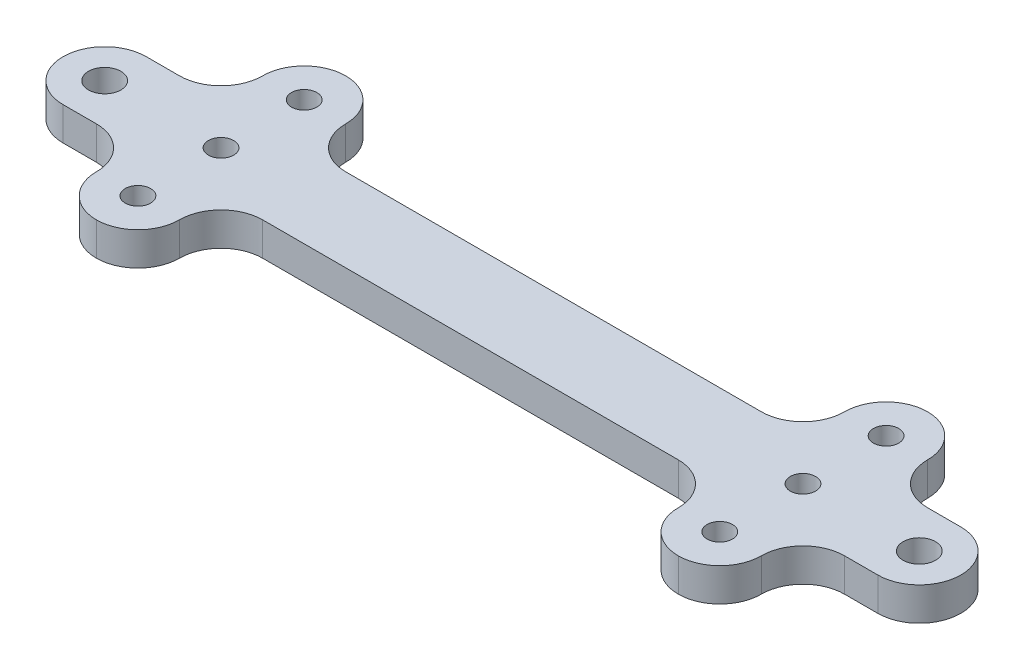
from build123d import *

# Parameters (mm, degrees)
BOSS_EXTRUDE1_START = -19.5
SKETCH1_R           = 1.95
BOSS_EXTRUDE1_DEPTH = 4
SKETCH2_W           = 10
SKETCH2_H           = 10
SKETCH2_R           = 1.525
BOSS_EXTRUDE2_DEPTH = 4
SKETCH2_3_R         = 1.525
CUT_EXTRUDE1_DEPTH  = 4
FILLET1_START       = -24
FILLET1_DEPTH       = 5
FILLET1_START_2     = -23.5
FILLET1_2_DEPTH     = 4


with BuildPart() as part:
    # Sketch1 → Boss-Extrude1 (new body)
    with BuildSketch(Plane(origin=(0, 0, 0), x_dir=(1, 0, 0), z_dir=(0, 1, 0)).offset(BOSS_EXTRUDE1_START)):
        with BuildLine():
            Line((43.9, 5), (-54.1, 5))
            ThreePointArc((-54.1, 5), (-59.1, 0), (-54.1, -5))
            Line((-54.1, -5), (43.9, -5))
            ThreePointArc((43.9, -5), (48.9, 0), (43.9, 5))
        make_face()
        with Locations(Location((43.9, 0, 0), (0, 0, 270))):
            Circle(SKETCH1_R, mode=Mode.SUBTRACT)
        with Locations(Location((-54.1, 0, 0), (0, 0, 270))):
            Circle(SKETCH1_R, mode=Mode.SUBTRACT)
    extrude(amount=-BOSS_EXTRUDE1_DEPTH)

    # Sketch2 → Boss-Extrude2 (add)
    # profile 1 of 4: a face of its own
    with BuildSketch(Plane(origin=(0, -19.5, 0), x_dir=(1, 0, 0), z_dir=(0, 1, 0))):
        with Locations((-40.1, -10)):
            Rectangle(SKETCH2_W, SKETCH2_H)
        with Locations(Location((-40.1, -10, 0), (0, 0, 270))):
            Circle(SKETCH2_R, mode=Mode.SUBTRACT)
    # profile 2 of 4: a face of its own
    with BuildSketch(Plane(origin=(0, -19.5, 0), x_dir=(1, 0, 0), z_dir=(0, 1, 0))):
        with Locations((-40.1, 10)):
            Rectangle(SKETCH2_W, SKETCH2_H)
        with Locations(Location((-40.1, 10, 0), (0, 0, 270))):
            Circle(SKETCH2_R, mode=Mode.SUBTRACT)
    # profile 3 of 4: a face of its own
    with BuildSketch(Plane(origin=(0, -19.5, 0), x_dir=(1, 0, 0), z_dir=(0, 1, 0))):
        with Locations((29.9, 10)):
            Rectangle(SKETCH2_W, SKETCH2_H)
        with Locations(Location((29.9, 10, 0), (0, 0, 270))):
            Circle(SKETCH2_R, mode=Mode.SUBTRACT)
    # profile 4 of 4: a face of its own
    with BuildSketch(Plane(origin=(0, -19.5, 0), x_dir=(1, 0, 0), z_dir=(0, 1, 0))):
        with Locations((29.9, -10)):
            Rectangle(SKETCH2_W, SKETCH2_H)
        with Locations(Location((29.9, -10, 0), (0, 0, 270))):
            Circle(SKETCH2_R, mode=Mode.SUBTRACT)
    extrude(amount=-BOSS_EXTRUDE2_DEPTH)

    # Sketch2<3> → Cut-Extrude1 (cut)
    with BuildSketch(Plane(origin=(0, -19.5, 0), x_dir=(1, 0, 0), z_dir=(0, 1, 0))):
        with Locations(Location((29.9, 0, 0), (0, 0, 270))):
            Circle(SKETCH2_3_R)
        with Locations(Location((-40.1, 0, 0), (0, 0, 270))):
            Circle(SKETCH2_3_R)
    extrude(amount=-CUT_EXTRUDE1_DEPTH, mode=Mode.SUBTRACT)

    # Fillet1: read off the stored shape, not the designer's step
    # Fillet1 outline → Fillet1 (cut)
    with BuildSketch(Plane(origin=(0, 0, 0), x_dir=(1, 0, 0), z_dir=(0, 1, 0)).offset(FILLET1_START)):
        with BuildLine():
            Line((34.9, -15), (34.9, -10))
            ThreePointArc((34.9, -10), (33.435533906, -13.535533906), (29.9, -15))
            Line((29.9, -15), (34.9, -15))
        make_face()
        with BuildLine():
            Line((-45.1, -15), (-40.1, -15))
            ThreePointArc((-40.1, -15), (-43.635533906, -13.535533906), (-45.1, -10))
            Line((-45.1, -10), (-45.1, -15))
        make_face()
        with BuildLine():
            Line((-35.1, -15), (-35.1, -10))
            ThreePointArc((-35.1, -10), (-36.564466094, -13.535533906), (-40.1, -15))
            Line((-40.1, -15), (-35.1, -15))
        make_face()
        with BuildLine():
            Line((24.9, -15), (29.9, -15))
            ThreePointArc((29.9, -15), (26.364466094, -13.535533906), (24.9, -10))
            Line((24.9, -10), (24.9, -15))
        make_face()
        with BuildLine():
            Line((34.9, 15), (29.9, 15))
            ThreePointArc((29.9, 15), (33.435533906, 13.535533906), (34.9, 10))
            Line((34.9, 10), (34.9, 15))
        make_face()
        with BuildLine():
            Line((24.9, 15), (24.9, 10))
            ThreePointArc((24.9, 10), (26.364466094, 13.535533906), (29.9, 15))
            Line((29.9, 15), (24.9, 15))
        make_face()
        with BuildLine():
            ThreePointArc((-45.1, 10), (-43.635533906, 13.535533906), (-40.1, 15))
            Line((-40.1, 15), (-45.1, 15))
            Line((-45.1, 15), (-45.1, 10))
        make_face()
        with BuildLine():
            ThreePointArc((-40.1, 15), (-36.564466094, 13.535533906), (-35.1, 10))
            Line((-35.1, 10), (-35.1, 15))
            Line((-35.1, 15), (-40.1, 15))
        make_face()
    extrude(amount=FILLET1_DEPTH, mode=Mode.SUBTRACT)

    # Fillet1 2 outline → Fillet1 2 (add)
    with BuildSketch(Plane(origin=(0, 0, 0), x_dir=(1, 0, 0), z_dir=(0, 1, 0)).offset(FILLET1_START_2)):
        with BuildLine():
            Line((34.9, -5), (34.9, -10))
            ThreePointArc((34.9, -10), (36.364466094, -6.464466094), (39.9, -5))
            Line((39.9, -5), (34.9, -5))
        make_face()
        with BuildLine():
            ThreePointArc((-50.1, -5), (-46.564466094, -6.464466094), (-45.1, -10))
            Line((-45.1, -10), (-45.1, -5))
            Line((-45.1, -5), (-50.1, -5))
        make_face()
        with BuildLine():
            ThreePointArc((-35.1, -10), (-33.635533906, -6.464466094), (-30.1, -5))
            Line((-30.1, -5), (-35.1, -5))
            Line((-35.1, -5), (-35.1, -10))
        make_face()
        with BuildLine():
            ThreePointArc((19.9, -5), (23.435533906, -6.464466094), (24.9, -10))
            Line((24.9, -10), (24.9, -5))
            Line((24.9, -5), (19.9, -5))
        make_face()
        with BuildLine():
            ThreePointArc((39.9, 5), (36.364466094, 6.464466094), (34.9, 10))
            Line((34.9, 10), (34.9, 5))
            Line((34.9, 5), (39.9, 5))
        make_face()
        with BuildLine():
            Line((-45.1, 5), (-45.1, 10))
            ThreePointArc((-45.1, 10), (-46.564466094, 6.464466094), (-50.1, 5))
            Line((-50.1, 5), (-45.1, 5))
        make_face()
        with BuildLine():
            Line((-35.1, 5), (-30.1, 5))
            ThreePointArc((-30.1, 5), (-33.635533906, 6.464466094), (-35.1, 10))
            Line((-35.1, 10), (-35.1, 5))
        make_face()
        with BuildLine():
            ThreePointArc((24.9, 10), (23.435533906, 6.464466094), (19.9, 5))
            Line((19.9, 5), (24.9, 5))
            Line((24.9, 5), (24.9, 10))
        make_face()
    extrude(amount=FILLET1_2_DEPTH)


solid = part.part
